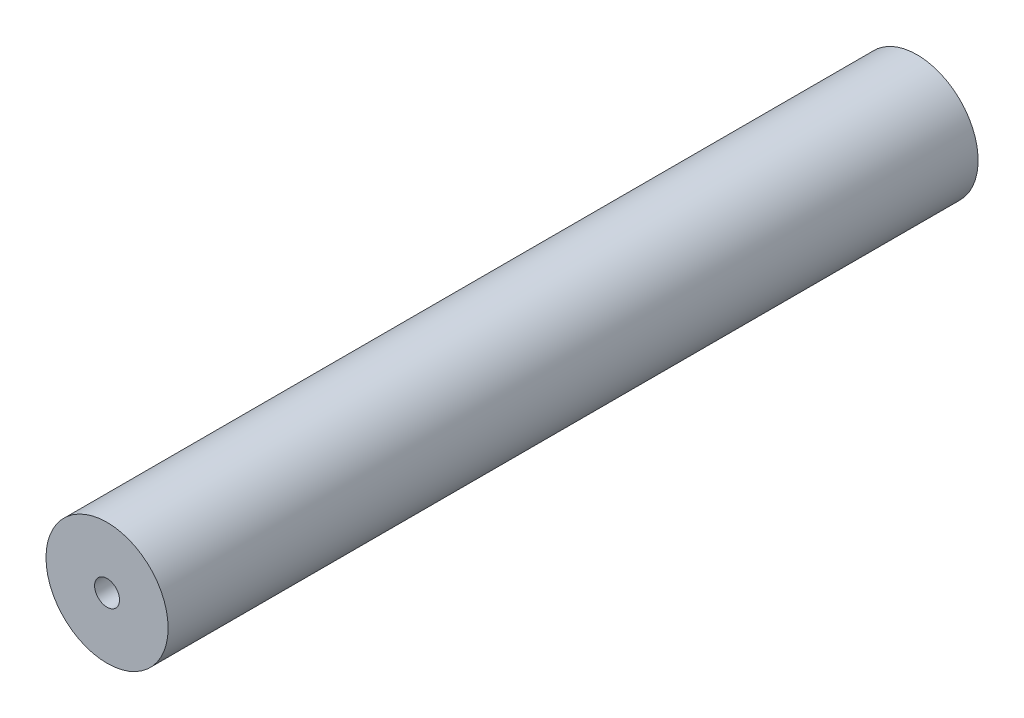
from build123d import *

# Parameters (mm, degrees)
P_IDAT_VYSUNUT_M1_DEPTH       = 2
VYSUNOUT_TENKOST_NN_2_DEPTH   = 2
SKICA4_R                      = 4.9
P_IDAT_VYSUNUT_M2_DEPTH       = 65
SKICA5_R                      = 1
ODEBRAT_VYSUNUT_M1_DEPTH      = 5
P_IDAT_VYSUNUT_M3_DEPTH       = 2
P_IDAT_VYSUNUT_M4_DEPTH       = 2
ODEBRAT_VYSUNUT_M2_DEPTH      = 94.281831028
ODEBRAT_VYSUNUT_M2_DEPTH_BACK = 94.281831028
SKICA8_OUTSIDE_W              = 95.448
SKICA8_OUTSIDE_H              = 89.948
SKICA8_OUTSIDE_W_2            = 9.9
SKICA8_OUTSIDE_H_2            = 65


# Read off the part's stored shape, not the designer's step: Rozdělit1
with BuildPart() as part:
    # Skica1 → Přidat vysunutím1 (new body)
    with BuildSketch(Plane.XY):
        with BuildLine():
            Line((0, 5), (-60, 5))
            Line((-60, 5), (-60, -5))
            Line((-60, -5), (0, -5))
            ThreePointArc((0, -5), (5, 0), (0, 5))
        make_face()
    extrude(amount=P_IDAT_VYSUNUT_M1_DEPTH)

    # Skica3 → Vysunout tenkostěnný2 (add)
    with BuildSketch(Plane.XY):
        with BuildLine():
            Line((-50, -16.5), (-60, -16.5))
            ThreePointArc((-60, -16.5), (-61.5, -15), (-60, -13.5))
            Line((-60, -13.5), (-50, -13.5))
            ThreePointArc((-50, -13.5), (-47.5, -11), (-50, -8.5))
            Line((-50, -8.5), (-60, -8.5))
            ThreePointArc((-60, -8.5), (-61.5, -7), (-60, -5.5))
            Line((-60, -5.5), (-50, -5.5))
            Line((-50, -5.5), (-50, -4.5))
            Line((-50, -4.5), (-60, -4.5))
            ThreePointArc((-60, -4.5), (-62.5, -7), (-60, -9.5))
            Line((-60, -9.5), (-50, -9.5))
            ThreePointArc((-50, -9.5), (-48.5, -11), (-50, -12.5))
            Line((-50, -12.5), (-60, -12.5))
            ThreePointArc((-60, -12.5), (-62.5, -15), (-60, -17.5))
            Line((-60, -17.5), (-50, -17.5))
            Line((-50, -17.5), (-50, -16.5))
        make_face()
    extrude(amount=VYSUNOUT_TENKOST_NN_2_DEPTH)


with BuildPart() as body_2:
    # Rozdělit1: the piece on the far side of the plane
    add(part.part)
    split(bisect_by=Plane(origin=(0, 0, 0), x_dir=(1, 0, 0), z_dir=(0, 1, 0)), keep=Keep.BOTTOM)

    # Zrcadlit3: body 2 across plane


with BuildPart() as part_1:
    add(part.part)

    # Rozdělit1
    split(bisect_by=Plane(origin=(0, 0, 0), x_dir=(1, 0, 0), z_dir=(0, 1, 0)), keep=Keep.TOP)


with BuildPart() as body_2_1:
    add(body_2.part)
    add(body_2.part.mirror(Plane.ZX))

    # Skica4 → Přidat vysunutím2 (add)
    with BuildSketch(Plane.XY.offset(2)):
        Circle(SKICA4_R)
    extrude(amount=P_IDAT_VYSUNUT_M2_DEPTH)

    # Skica5 → Odebrat vysunutím1 (cut)
    with BuildSketch(Plane.XY.offset(67)):
        Circle(SKICA5_R)
    extrude(amount=-ODEBRAT_VYSUNUT_M1_DEPTH, mode=Mode.SUBTRACT)

    # Skica6 → Přidat vysunutím3 (add)
    with BuildSketch(Plane(origin=(0, 0, 0), x_dir=(-1, 0, 0), z_dir=(0, 0, -1))):
        with BuildLine():
            Line((0, 5), (-5, 5))
            ThreePointArc((-5, 5), (-10, 0), (-5, -5))
            Line((-5, -5), (0, -5))
            ThreePointArc((0, -5), (-5, 0), (0, 5))
        make_face()
    extrude(amount=-P_IDAT_VYSUNUT_M3_DEPTH)

    # Skica7 → Přidat vysunutím4 (add)
    with BuildSketch(Plane.XY.offset(2)):
        with BuildLine():
            Line((-50, 5), (-50, -5))
            Line((-50, -5), (-50, -5.5))
            Line((-50, -5.5), (-60, -5.5))
            ThreePointArc((-60, -5.5), (-61.5, -7), (-60, -8.5))
            Line((-60, -8.5), (-50, -8.5))
            ThreePointArc((-50, -8.5), (-47.5, -11), (-50, -13.5))
            Line((-50, -13.5), (-60, -13.5))
            ThreePointArc((-60, -13.5), (-61.5, -15), (-60, -16.5))
            Line((-60, -16.5), (-50, -16.5))
            Line((-50, -16.5), (-50, -17.5))
            Line((-50, -17.5), (-60, -17.5))
            ThreePointArc((-60, -17.5), (-62.5, -15), (-60, -12.5))
            Line((-60, -12.5), (-50, -12.5))
            ThreePointArc((-50, -12.5), (-48.5, -11), (-50, -9.5))
            Line((-50, -9.5), (-60, -9.5))
            ThreePointArc((-60, -9.5), (-62.5, -7), (-60, -4.5))
            Line((-60, -4.5), (-60, 4.5))
            ThreePointArc((-60, 4.5), (-62.5, 7), (-60, 9.5))
            Line((-60, 9.5), (-50, 9.5))
            ThreePointArc((-50, 9.5), (-48.5, 11), (-50, 12.5))
            Line((-50, 12.5), (-60, 12.5))
            ThreePointArc((-60, 12.5), (-62.5, 15), (-60, 17.5))
            Line((-60, 17.5), (-50, 17.5))
            Line((-50, 17.5), (-50, 16.5))
            Line((-50, 16.5), (-60, 16.5))
            ThreePointArc((-60, 16.5), (-61.5, 15), (-60, 13.5))
            Line((-60, 13.5), (-50, 13.5))
            ThreePointArc((-50, 13.5), (-47.5, 11), (-50, 8.5))
            Line((-50, 8.5), (-60, 8.5))
            ThreePointArc((-60, 8.5), (-61.5, 7), (-60, 5.5))
            Line((-60, 5.5), (-50, 5.5))
            Line((-50, 5.5), (-50, 5))
        make_face()
    extrude(amount=P_IDAT_VYSUNUT_M4_DEPTH)

    # Skica8 outside → Odebrat vysunutím2 (cut, two sides: drawn at the far end of the back side and taken through both)
    with BuildSketch(Plane(origin=(0, 0, 0), x_dir=(1, 0, 0), z_dir=(0, 1, 0)).offset(-ODEBRAT_VYSUNUT_M2_DEPTH_BACK)):
        with Locations((-26.25, -33.5)):
            Rectangle(SKICA8_OUTSIDE_W, SKICA8_OUTSIDE_H)
        with Locations((0.05, -34.5)):
            Rectangle(SKICA8_OUTSIDE_W_2, SKICA8_OUTSIDE_H_2, mode=Mode.SUBTRACT)
    extrude(amount=ODEBRAT_VYSUNUT_M2_DEPTH + ODEBRAT_VYSUNUT_M2_DEPTH_BACK, mode=Mode.SUBTRACT)


solid = body_2_1.part
